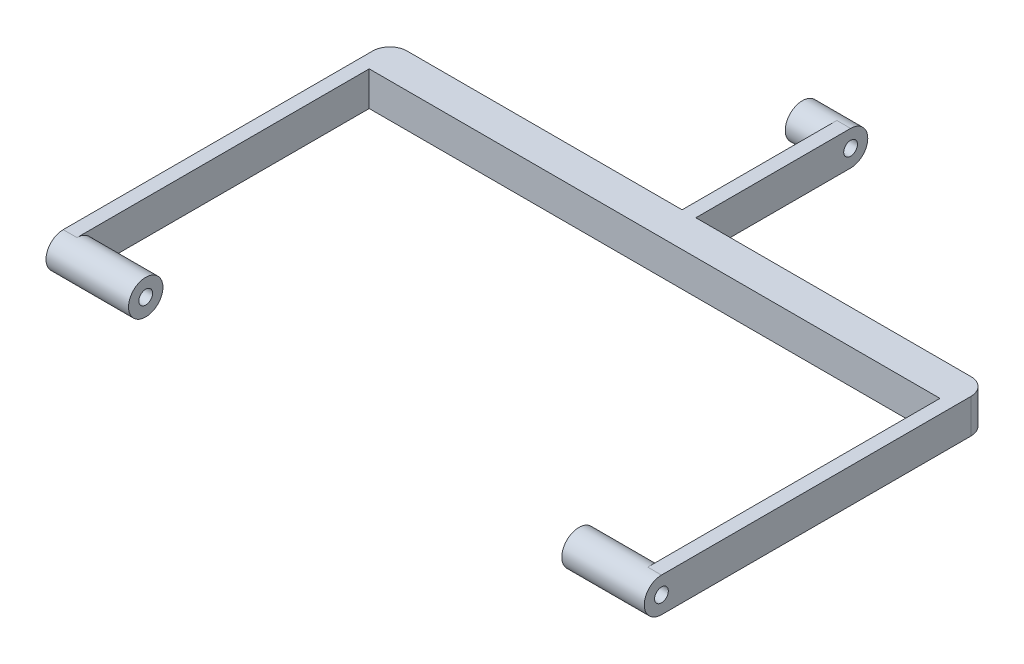
from build123d import *

# Parameters (mm, degrees)
ESBO_O1_W                  = 87
ESBO_O1_H                  = 5
RESSALTO_EXTRUS_O1_DEPTH   = 5
ESBO_O2_W                  = 2
ESBO_O2_H                  = 50
RESSALTO_EXTRUS_O2_DEPTH   = 5
FILETE1_R                  = 2.5
ESBO_O6_R                  = 2.5
RESSALTO_EXTRUS_O4_DEPTH   = 10
ESBO_O7_R                  = 1
CORTE_EXTRUS_O3_DEPTH      = 89.917096219
FILETE1_OF_ESPELHAR1_R     = 2.5
FILETE2_R                  = 2.5
ESBO_O4_W                  = 30
ESBO_O4_H                  = 5
RESSALTO_EXTRUS_O3_DEPTH   = 1
FILETE3_R                  = 2.5
ESBO_O8_R                  = 2.5
RESSALTO_EXTRUS_O5_DEPTH   = 5
CORTE_EXTRUS_O2_DEPTH      = 65.602631525
CORTE_EXTRUS_O2_DEPTH_BACK = 65.602631525
ESBO_O5_R                  = 1


with BuildPart() as part:
    # Esboço1 → Ressalto-extrusão1 (new body)
    with BuildSketch(Plane(origin=(0, 0, 0), x_dir=(1, 0, 0), z_dir=(0, 1, 0))):
        Rectangle(ESBO_O1_W, ESBO_O1_H)
    extrude(amount=RESSALTO_EXTRUS_O1_DEPTH)

    # Esboço2 → Ressalto-extrusão2 (add)
    with BuildSketch(Plane(origin=(0, 0, 0), x_dir=(1, 0, 0), z_dir=(0, 1, 0))):
        with Locations((-42.5, -22.5)):
            Rectangle(ESBO_O2_W, ESBO_O2_H)
    ressalto_extrus_o2 = extrude(amount=RESSALTO_EXTRUS_O2_DEPTH)

    # Filete1
    filete1_edges = [part.edges().sort_by_distance(p)[0] for p in [
        (-42.5, 0, 47.5),
        (-42.5, 5, 47.5),
    ]]
    fillet(filete1_edges, radius=FILETE1_R - 0.0001)  # a hair under: the kernel refuses the full size

    # Esboço6 → Ressalto-extrusão4 (add)
    with BuildSketch(Plane(origin=(-41.5, 0, 0), x_dir=(0, 0, -1), z_dir=(1, 0, 0))):
        with Locations((-45, 2.5)):
            Circle(ESBO_O6_R)
    ressalto_extrus_o4 = extrude(amount=RESSALTO_EXTRUS_O4_DEPTH)

    # Esboço7 → Corte-extrusão3 (cut, through all)
    with BuildSketch(Plane(origin=(-31.5, 0, 0), x_dir=(0, 0, -1), z_dir=(1, 0, 0))):
        with Locations((-45, 2.5)):
            Circle(ESBO_O7_R)
    corte_extrus_o3 = extrude(amount=-CORTE_EXTRUS_O3_DEPTH, mode=Mode.SUBTRACT)

    # Espelhar1: Ressalto-extrusão2, Ressalto-extrusão4, Corte-extrusão3 across plane
    add(ressalto_extrus_o2.mirror(Plane(origin=(0, 0, 0), x_dir=(0, 0, 1), z_dir=(1, 0, 0))))
    add(ressalto_extrus_o4.mirror(Plane(origin=(0, 0, 0), x_dir=(0, 0, 1), z_dir=(1, 0, 0))))
    add(corte_extrus_o3.mirror(Plane(origin=(0, 0, 0), x_dir=(0, 0, 1), z_dir=(1, 0, 0))), mode=Mode.SUBTRACT)

    # Filete1 of Espelhar1
    filete1_of_espelhar1_edges = [part.edges().sort_by_distance(p)[0] for p in [
        (42.5, 0, 47.5),
        (42.5, 5, 47.5),
    ]]
    fillet(filete1_of_espelhar1_edges, radius=FILETE1_OF_ESPELHAR1_R - 0.0001)  # a hair under: the kernel refuses the full size

    # Filete2
    filete2_edges = [part.edges().sort_by_distance(p)[0] for p in [
        (-43.5, 2.5, -2.5),
        (43.5, 2.5, -2.5),
    ]]
    fillet(filete2_edges, radius=FILETE2_R)

    # Esboço4 → Ressalto-extrusão3 (add, symmetric)
    with BuildSketch(Plane(origin=(0, 0, 0), x_dir=(0, 0, -1), z_dir=(1, 0, 0))):
        with Locations((12.5, 2.5)):
            Rectangle(ESBO_O4_W, ESBO_O4_H)
    extrude(amount=RESSALTO_EXTRUS_O3_DEPTH, both=True)

    # Filete3
    filete3_edges = [part.edges().sort_by_distance(p)[0] for p in [
        (0, 5, -27.5),
        (0, 0, -27.5),
    ]]
    fillet(filete3_edges, radius=FILETE3_R - 0.0001)  # a hair under: the kernel refuses the full size

    # Esboço8 → Ressalto-extrusão5 (add)
    with BuildSketch(Plane.ZY.offset(1)):
        with Locations((-25, 2.5)):
            Circle(ESBO_O8_R)
    extrude(amount=RESSALTO_EXTRUS_O5_DEPTH)

    # Esboço5 → Corte-extrusão2 (cut, two sides: drawn at the far end of the back side and taken through both)
    with BuildSketch(Plane(origin=(0, 0, 0), x_dir=(0, 0, -1), z_dir=(1, 0, 0)).offset(-CORTE_EXTRUS_O2_DEPTH_BACK)):
        with Locations((25, 2.5)):
            Circle(ESBO_O5_R)
    extrude(amount=CORTE_EXTRUS_O2_DEPTH + CORTE_EXTRUS_O2_DEPTH_BACK, mode=Mode.SUBTRACT)


solid = part.part
